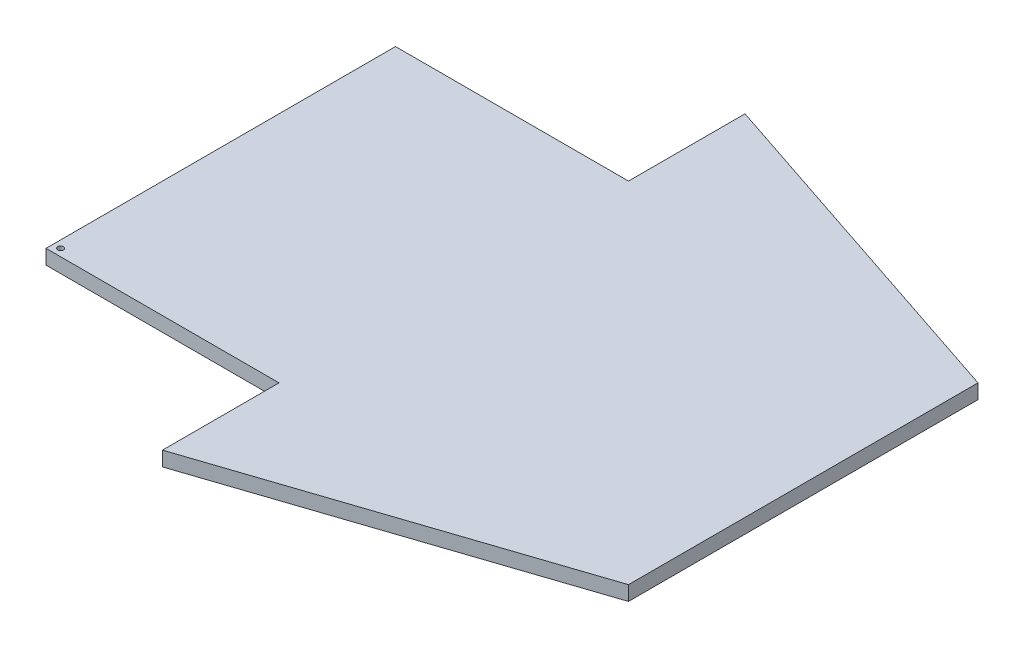
from build123d import *

# Parameters (mm, degrees)
MAIN_FIN_DEPTH = 6.35
SKETCH2_R      = 1.27
PIN_HOLE_DEPTH = 297.280411941


with BuildPart() as part:
    # Sketch1 → Main fin (new body)
    with BuildSketch(Plane(origin=(0, 0, 0), x_dir=(1, 0, 0), z_dir=(0, 1, 0))):
        Polygon((0, 254), (152.4, 203.2), (152.4, 50.8), (0, 0), (0, 50.8), (-101.6, 50.8), (-101.6, 203.2), (0, 203.2), align=None)
    extrude(amount=MAIN_FIN_DEPTH)

    # Sketch2 → Pin hole (cut, through all)
    with BuildSketch(Plane(origin=(0, 0, 0), x_dir=(-1, 0, 0), z_dir=(0, -1, 0))):
        with Locations((98.425, 53.975)):
            Circle(SKETCH2_R)
    extrude(amount=-PIN_HOLE_DEPTH, mode=Mode.SUBTRACT)


solid = part.part
